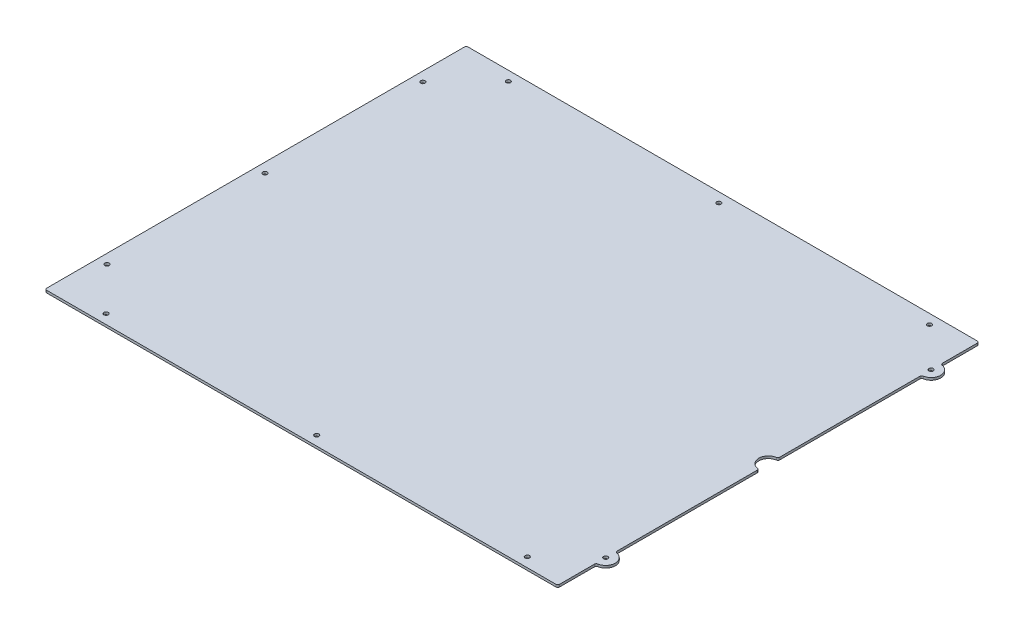
from build123d import *

# Parameters (mm, degrees)
BOSS_EXTRUDE1_DEPTH        = 3.175
FILLET1_R                  = 2.54
F_1_0_228_DIAMETER_HOLE1_D = 5.7912


with BuildPart() as part:
    # Sketch1 → Boss-Extrude1 (new body)
    with BuildSketch(Plane(origin=(0, 0, 0), x_dir=(1, 0, 0), z_dir=(0, 1, 0))):
        with BuildLine():
            Line((340.2584, 228.6), (340.2584, 279.5524))
            Line((340.2584, 279.5524), (-340.2584, 279.5524))
            Line((-340.2584, 279.5524), (-340.2584, -279.5524))
            Line((-340.2584, -279.5524), (340.2584, -279.5524))
            Line((340.2584, -279.5524), (340.2584, -228.6))
            ThreePointArc((340.2584, -228.6), (352.9584, -215.9), (340.2584, -203.2))
            Line((340.2584, -203.2), (340.2584, -12.7))
            ThreePointArc((340.2584, -12.7), (327.5584, 0), (340.2584, 12.7))
            Line((340.2584, 12.7), (340.2584, 203.2))
            ThreePointArc((340.2584, 203.2), (352.9584, 215.9), (340.2584, 228.6))
        make_face()
    extrude(amount=BOSS_EXTRUDE1_DEPTH)

    # Fillet1
    fillet1_edges = [part.edges().sort_by_distance(p)[0] for p in [
        (-340.2584, 1.5875, -279.5524),
        (-340.2584, 1.5875, 279.5524),
        (340.2584, 1.5875, 279.5524),
        (340.2584, 1.5875, 228.6),
        (340.2584, 1.5875, 203.2),
        (340.2584, 1.5875, 12.7),
        (340.2584, 1.5875, -12.7),
        (340.2584, 1.5875, -203.2),
        (340.2584, 1.5875, -279.5524),
        (340.2584, 1.5875, -228.6),
    ]]
    fillet(fillet1_edges, radius=FILLET1_R)

    # #1 (0.228) Diameter Hole1 (through all)
    with Locations(Plane(origin=(0, 3.175, 0), x_dir=(1, 0, 0), z_dir=(0, 1, 0))):
        with Locations((287.274, 266.7), (340.2584, -215.9), (340.2584, 0), (340.2584, 215.9), (287.274, -267.0048), (7.874, -267.0048), (-271.526, -267.0048), (-327.5584, -209.7024), (-327.5584, -0.1524), (-327.5584, 209.3976), (-271.526, 266.7), (7.874, 266.7)):
            Hole(F_1_0_228_DIAMETER_HOLE1_D / 2)


solid = part.part
